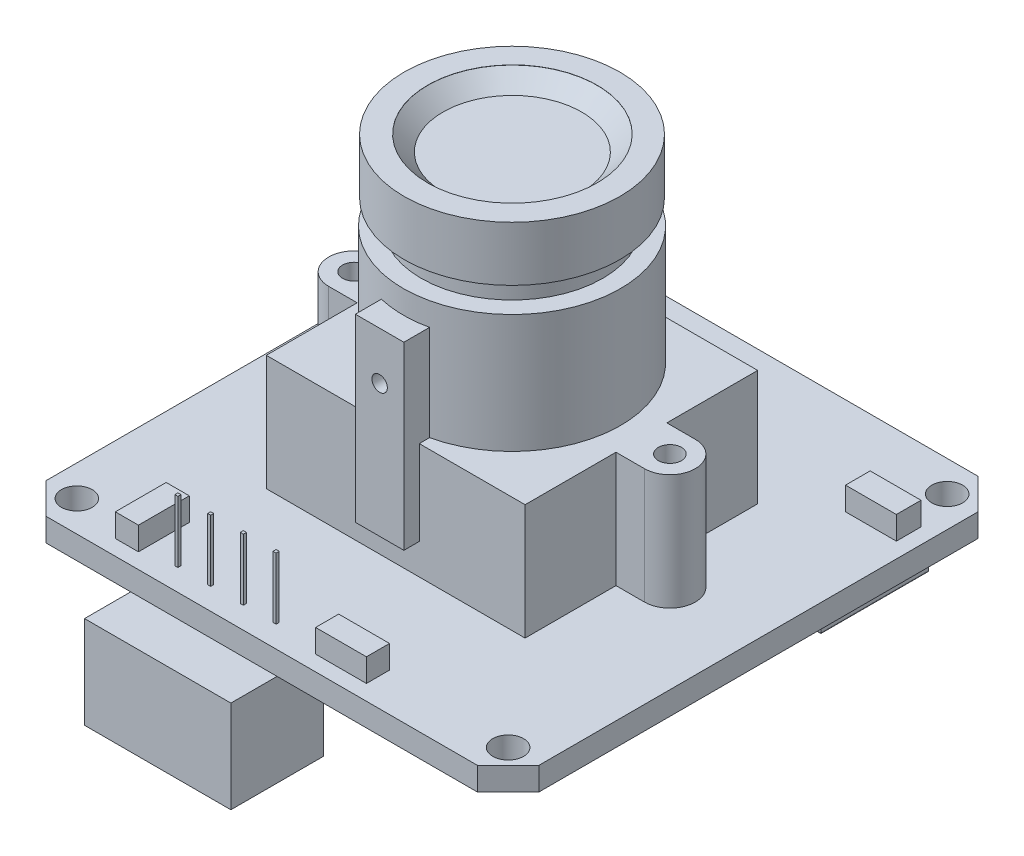
from build123d import *

# Parameters (mm, degrees)
SKETCH1_R                 = 1
BOSS_EXTRUDE1_DEPTH       = 1.501732894
BOSS_EXTRUDE3_DEPTH       = 7.5
SKETCH4_R                 = 7.05
BOSS_EXTRUDE4_DEPTH       = 7.7
SKETCH6_R                 = 5.9
BOSS_EXTRUDE5_DEPTH       = 1.6
SKETCH7_R                 = 7
BOSS_EXTRUDE6_DEPTH       = 3.55
SKETCH9_R                 = 5.5
CUT_EXTRUDE1_DEPTH        = 0.01
SKETCH10_R                = 4.5
CUT_EXTRUDE2_DEPTH        = 1
CHAMFER3_SIZE             = 1
SKETCH11_R                = 0.75
CUT_EXTRUDE3_DEPTH        = 9
BOSS_EXTRUDE8_DEPTH       = 1
BOSS_EXTRUDE8_DEPTH_BACK  = 1
SKETCH13_R                = 0.5
SKETCH14_W                = 8.5
SKETCH14_H                = 2.5
BOSS_EXTRUDE9_DEPTH       = 2
BOSS_EXTRUDE10_DEPTH      = 6
BOSS_EXTRUDE12_DEPTH      = 1.5
SKETCH17_W                = 4.5
SKETCH17_H                = 7
BOSS_EXTRUDE13_DEPTH      = 1.3
SKETCH18_W                = 18.1
SKETCH18_H                = 8.3
BOSS_EXTRUDE14_DEPTH      = 2.5
SKETCH19_R                = 2
CUT_EXTRUDE4_DEPTH        = 0.01
FILLET2_R                 = 0.1
SKETCH20_W                = 1.6
SKETCH20_H                = 3
BOSS_EXTRUDE16_DEPTH      = 1.5
SKETCH21_W                = 3
SKETCH21_H                = 1.5
BOSS_EXTRUDE17_DEPTH      = 1.5
BOSS_EXTRUDE18_DEPTH      = 1.5
SKETCH23_R                = 0.25
BOSS_EXTRUDE19_DEPTH      = 1.65
SKETCH26_W                = 3.3
SKETCH26_H                = 1.6
BOSS_EXTRUDE21_DEPTH      = 1.5
SKETCH27_W                = 3.3
SKETCH27_H                = 1.5
BOSS_EXTRUDE22_DEPTH      = 1.5
SKETCH28_W                = 1.5
SKETCH28_H                = 3.3
BOSS_EXTRUDE23_DEPTH      = 1.5
SKETCH29_W                = 3.3
SKETCH29_H                = 1.5
BOSS_EXTRUDE24_DEPTH      = 1.5
BOSS_EXTRUDE25_DEPTH      = 4
BOSS_EXTRUDE25_DEPTH_BACK = 5.5
SCALE1_SCALE              = 8


with BuildPart() as part:
    # Sketch1 → Boss-Extrude1 (new body)
    with BuildSketch(Plane(origin=(0, 0, 0), x_dir=(1, 0, 0), z_dir=(0, 1, 0))):
        Polygon((0, 2), (0, 30.5), (2, 32.5), (30, 32.5), (32, 30.5), (32, 2), (30, 0), (2, 0), align=None)
        with Locations(Location((2, 30.5, 0), (0, 0, 270))):
            Circle(SKETCH1_R, mode=Mode.SUBTRACT)
        with Locations(Location((2, 2, 0), (0, 0, 270))):
            Circle(SKETCH1_R, mode=Mode.SUBTRACT)
        with Locations(Location((30, 2, 0), (0, 0, 270))):
            Circle(SKETCH1_R, mode=Mode.SUBTRACT)
        with Locations(Location((30, 30.5, 0), (0, 0, 270))):
            Circle(SKETCH1_R, mode=Mode.SUBTRACT)
    extrude(amount=BOSS_EXTRUDE1_DEPTH)

    # Sketch3 → Boss-Extrude3 (add)
    with BuildSketch(Plane(origin=(0, 1.501732894, 0), x_dir=(1, 0, 0), z_dir=(0, 1, 0))):
        with BuildLine():
            Line((24.4, 14.6), (24.4, 8.7))
            Line((24.4, 8.7), (16, 8.7))
            Line((16, 8.7), (7.6, 8.7))
            Line((7.6, 8.7), (7.6, 14.6))
            Line((7.6, 14.6), (5.75, 14.6))
            ThreePointArc((5.75, 14.6), (4.1, 16.25), (5.75, 17.9))
            Line((5.75, 17.9), (7.6, 17.9))
            Line((7.6, 17.9), (7.6, 23.8))
            Line((7.6, 23.8), (16, 23.8))
            Line((16, 23.8), (24.4, 23.8))
            Line((24.4, 23.8), (24.4, 17.9))
            Line((24.4, 17.9), (26.25, 17.9))
            ThreePointArc((26.25, 17.9), (27.9, 16.25), (26.25, 14.6))
            Line((26.25, 14.6), (24.4, 14.6))
        make_face()
    extrude(amount=BOSS_EXTRUDE3_DEPTH)

    # Sketch4 → Boss-Extrude4 (add)
    with BuildSketch(Plane(origin=(0, 9.001732894, 0), x_dir=(1, 0, 0), z_dir=(0, 1, 0))):
        with Locations(Location((16, 16.25, 0), (0, 0, 90))):
            Circle(SKETCH4_R)
    extrude(amount=BOSS_EXTRUDE4_DEPTH)

    # Sketch6 → Boss-Extrude5 (add)
    with BuildSketch(Plane(origin=(0, 16.701732894, 0), x_dir=(1, 0, 0), z_dir=(0, 1, 0))):
        with Locations(Location((16, 16.25, 0), (0, 0, 270))):
            Circle(SKETCH6_R)
    extrude(amount=BOSS_EXTRUDE5_DEPTH)

    # Sketch7 → Boss-Extrude6 (add)
    with BuildSketch(Plane(origin=(0, 18.301732894, 0), x_dir=(1, 0, 0), z_dir=(0, 1, 0))):
        with Locations(Location((16, 16.25, 0), (0, 0, 270))):
            Circle(SKETCH7_R)
    extrude(amount=BOSS_EXTRUDE6_DEPTH)

    # Sketch9 → Cut-Extrude1 (cut)
    with BuildSketch(Plane(origin=(0, 21.851732894, 0), x_dir=(1, 0, 0), z_dir=(0, 1, 0))):
        with Locations(Location((16, 16.275, 0), (0, 0, 270))):
            Circle(SKETCH9_R)
    extrude(amount=-CUT_EXTRUDE1_DEPTH, mode=Mode.SUBTRACT)

    # Sketch10 → Cut-Extrude2 (cut)
    with BuildSketch(Plane(origin=(0, 21.841732894, 0), x_dir=(1, 0, 0), z_dir=(0, 1, 0))):
        with Locations(Location((16, 16.275, 0), (0, 0, 270))):
            Circle(SKETCH10_R)
    extrude(amount=-CUT_EXTRUDE2_DEPTH, mode=Mode.SUBTRACT)

    # Chamfer3
    chamfer3_edges = [part.edges().sort_by_distance(p)[0] for p in [
        (16, 21.841732894, -20.775),
    ]]
    chamfer(chamfer3_edges, length=CHAMFER3_SIZE - 0.0001)  # a hair under: the kernel refuses the full size

    # Sketch11 → Cut-Extrude3 (cut)
    with BuildSketch(Plane(origin=(0, 9.001732894, 0), x_dir=(1, 0, 0), z_dir=(0, 1, 0))):
        with Locations(Location((5.75, 16.25, 0), (0, 0, 270))):
            Circle(SKETCH11_R)
        with Locations(Location((26.25, 16.25, 0), (0, 0, 270))):
            Circle(SKETCH11_R)
    extrude(amount=-CUT_EXTRUDE3_DEPTH, mode=Mode.SUBTRACT)

    # Sketch13 → Boss-Extrude8 (add, two sides: drawn at the far end of the back side and taken through both)
    with BuildSketch(Plane.XY.offset(-8.7).offset(-BOSS_EXTRUDE8_DEPTH_BACK)):
        Polygon((14.381366483, 9.001732894), (14.381366483, 15.201732894), (17.531366483, 15.201732894), (17.531366483, 9.001732894), (17.531366483, 3.501732894), (14.381366483, 3.501732894), align=None)
        with Locations((15.956366483, 12.1)):
            Circle(SKETCH13_R, mode=Mode.SUBTRACT)
    extrude(amount=BOSS_EXTRUDE8_DEPTH + BOSS_EXTRUDE8_DEPTH_BACK)

    # Sketch14 → Boss-Extrude9 (add)
    with BuildSketch(Plane.XZ):
        with Locations((12.25, 1.25)):
            Rectangle(SKETCH14_W, SKETCH14_H)
        Polygon((16.5, 0), (8, 0), (8, -2.5), (10.5, -2.5), (10.5, -3), (14, -3), (14, -2.5), (16.5, -2.5), align=None)
    extrude(amount=BOSS_EXTRUDE9_DEPTH)

    # Sketch14<4> → Boss-Extrude10 (add)
    with BuildSketch(Plane.XZ):
        Polygon((8, 3), (7.5, 3), (7.5, 2.5), (7.5, 0), (8, 0), (8, 2.5), (16.5, 2.5), (16.5, 0), (17, 0), (17, 3), (16.5, 3), align=None)
        Polygon((17, -3), (17, 0), (16.5, 0), (16.5, -2.5), (14, -2.5), (14, -3), (16.5, -3), align=None)
        Polygon((8, 0), (7.5, 0), (7.5, -2.5), (7.5, -3), (8, -3), (10.5, -3), (10.5, -2.5), (8, -2.5), align=None)
    extrude(amount=BOSS_EXTRUDE10_DEPTH)

    # Sketch16 → Boss-Extrude12 (add)
    with BuildSketch(Plane.XZ):
        Polygon((27, -2), (18, -2), (17.5, -2.5), (17.5, -11.5), (18, -12), (27, -12), (27.5, -11.5), (27.5, -2.5), align=None)
    extrude(amount=BOSS_EXTRUDE12_DEPTH)

    # Sketch17 → Boss-Extrude13 (add)
    with BuildSketch(Plane(origin=(0, 0, 0), x_dir=(-1, 0, 0), z_dir=(0, -1, 0))):
        with Locations((-28.75, 24.8)):
            Rectangle(SKETCH17_W, SKETCH17_H)
    extrude(amount=BOSS_EXTRUDE13_DEPTH)

    # Sketch18 → Boss-Extrude14 (add)
    with BuildSketch(Plane.XZ):
        with Locations((16.45, -25.45)):
            Rectangle(SKETCH18_W, SKETCH18_H)
    extrude(amount=BOSS_EXTRUDE14_DEPTH)

    # Sketch19 → Cut-Extrude4 (cut)
    with BuildSketch(Plane.XZ):
        with Locations(Location((5.75, -16.25, 0), (0, 0, 270))):
            Circle(SKETCH19_R)
        with Locations(Location((26.25, -16.25, 0), (0, 0, 270))):
            Circle(SKETCH19_R)
    extrude(amount=-CUT_EXTRUDE4_DEPTH, mode=Mode.SUBTRACT)

    # Fillet2
    fillet2_edges = [part.edges().sort_by_distance(p)[0] for p in [
        (31, -1.3, -24.8),
        (28.75, -1.3, -21.3),
        (26.5, -1.3, -24.8),
        (28.75, -1.3, -28.3),
    ]]
    fillet(fillet2_edges, radius=FILLET2_R)

    # Sketch20 → Boss-Extrude16 (add)
    with BuildSketch(Plane(origin=(0, 0, 0), x_dir=(-1, 0, 0), z_dir=(0, -1, 0))):
        with Locations((-2.8, 16.7)):
            Rectangle(SKETCH20_W, SKETCH20_H)
    extrude(amount=BOSS_EXTRUDE16_DEPTH)

    # Sketch21 → Boss-Extrude17 (add)
    with BuildSketch(Plane(origin=(0, 0, 0), x_dir=(-1, 0, 0), z_dir=(0, -1, 0))):
        with Locations((-1.65, 22.45)):
            Rectangle(SKETCH21_W, SKETCH21_H)
    extrude(amount=BOSS_EXTRUDE17_DEPTH)

    # Sketch22 → Boss-Extrude18 (add)
    with BuildSketch(Plane.XZ):
        Polygon((1.65, -25.647382046), (3.15, -25.647382046), (4.65, -25.647382046), (4.65, -27.147382046), (1.65, -27.147382046), align=None)
    extrude(amount=BOSS_EXTRUDE18_DEPTH)

    # Sketch23 → Boss-Extrude19 (add)
    with BuildSketch(Plane.XZ):
        with Locations(Location((11.525, -6.489371686, 0), (0, 0, 90))):
            Circle(SKETCH23_R)
        with Locations(Location((13.257244564, -6.489371686, 0), (0, 0, 90))):
            Circle(SKETCH23_R)
    extrude(amount=BOSS_EXTRUDE19_DEPTH)

    # Sketch26 → Boss-Extrude21 (add)
    with BuildSketch(Plane(origin=(0, 1.501732894, 0), x_dir=(1, 0, 0), z_dir=(0, 1, 0))):
        with Locations((29.35, 27)):
            Rectangle(SKETCH26_W, SKETCH26_H)
    extrude(amount=BOSS_EXTRUDE21_DEPTH)

    # Sketch27 → Boss-Extrude22 (add)
    with BuildSketch(Plane(origin=(0, 1.501732894, 0), x_dir=(1, 0, 0), z_dir=(0, 1, 0))):
        with Locations((2.65, 19.75)):
            Rectangle(SKETCH27_W, SKETCH27_H)
    extrude(amount=BOSS_EXTRUDE22_DEPTH)

    # Sketch28 → Boss-Extrude23 (add)
    with BuildSketch(Plane(origin=(0, 1.501732894, 0), x_dir=(1, 0, 0), z_dir=(0, 1, 0))):
        with Locations((6.25, 2.65)):
            Rectangle(SKETCH28_W, SKETCH28_H)
    extrude(amount=BOSS_EXTRUDE23_DEPTH)

    # Sketch29 → Boss-Extrude24 (add)
    with BuildSketch(Plane(origin=(0, 1.501732894, 0), x_dir=(1, 0, 0), z_dir=(0, 1, 0))):
        with Locations((20.15, 1.75)):
            Rectangle(SKETCH29_W, SKETCH29_H)
    extrude(amount=BOSS_EXTRUDE24_DEPTH)

    # Sketch25 → Boss-Extrude25 (add, two sides: drawn at the far end of the back side and taken through both)
    with BuildSketch(Plane(origin=(0, 1.501732894, 0), x_dir=(1, 0, 0), z_dir=(0, 1, 0)).offset(-BOSS_EXTRUDE25_DEPTH_BACK)):
        Polygon((9.1625, 1.4), (9.1625, 1.6), (9.0625, 1.6), (8.9625, 1.6), (8.9625, 1.4), align=None)
        Polygon((11.2875, 1.4), (11.2875, 1.6), (11.1875, 1.6), (11.0875, 1.6), (11.0875, 1.4), align=None)
        Polygon((13.4125, 1.4), (13.4125, 1.6), (13.3125, 1.6), (13.2125, 1.6), (13.2125, 1.4), align=None)
        Polygon((15.5375, 1.4), (15.5375, 1.6), (15.4375, 1.6), (15.3375, 1.6), (15.3375, 1.4), align=None)
    extrude(amount=BOSS_EXTRUDE25_DEPTH + BOSS_EXTRUDE25_DEPTH_BACK)


with BuildPart() as part_1:
    # Scale1: scaled about (16.115580509, 6.288907288, -16.14579311)
    add(part.part.scale(SCALE1_SCALE).moved(Location((-112.809063563, -44.022351016, 113.02055177))))


solid = part_1.part
